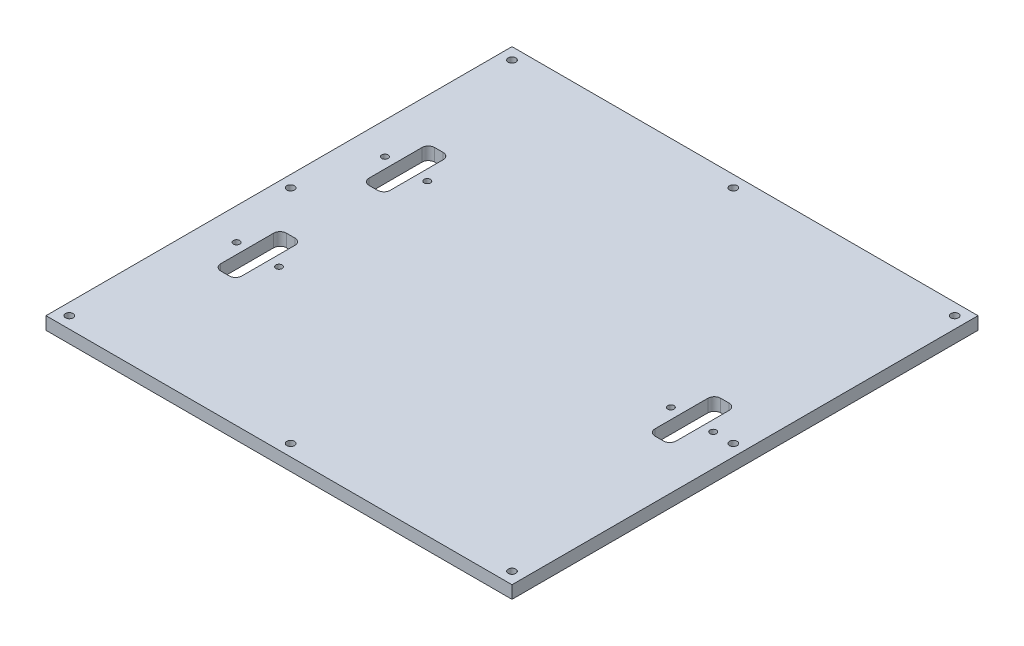
from build123d import *

# Parameters (mm, degrees)
SKETCH1_W                  = 220
SKETCH1_H                  = 220
BOSS_EXTRUDE1_DEPTH        = 6
SKETCH2_R                  = 1.5
SKETCH2_W                  = 10
SKETCH2_H                  = 31
CUT_EXTRUDE1_DEPTH         = 156.679157243
FILLET1_R                  = 3
SKETCH5_R                  = 1.5
SKETCH5_W                  = 10
SKETCH5_H                  = 31
CUT_EXTRUDE3_DEPTH         = 221.647074026
FILLET2_R                  = 3
SKETCH7_R                  = 1.5
SKETCH7_W                  = 10
SKETCH7_H                  = 31
CUT_EXTRUDE4_DEPTH         = 290.223994519
FILLET3_R                  = 3
F_3_6_3_6_DIAMETER_HOLE1_D = 3.6


with BuildPart() as part:
    # Sketch1 → Boss-Extrude1 (new body)
    with BuildSketch(Plane(origin=(0, 0, 0), x_dir=(1, 0, 0), z_dir=(0, 1, 0))):
        Rectangle(SKETCH1_W, SKETCH1_H)
    extrude(amount=BOSS_EXTRUDE1_DEPTH)

    # Sketch2 → Cut-Extrude1 (cut, through all)
    with BuildSketch(Plane(origin=(0, 6, 0), x_dir=(1, 0, 0), z_dir=(0, 1, 0))):
        with Locations((-95, 35)):
            Circle(SKETCH2_R)
        with Locations((-75, 35)):
            Circle(SKETCH2_R)
        with Locations((-85, 35)):
            Rectangle(SKETCH2_W, SKETCH2_H)
    extrude(amount=-CUT_EXTRUDE1_DEPTH, mode=Mode.SUBTRACT)

    # Fillet1
    fillet1_edges = [part.edges().sort_by_distance(p)[0] for p in [
        (-80, 3, -19.5),
        (-90, 3, -19.5),
        (-80, 3, -50.5),
        (-90, 3, -50.5),
    ]]
    fillet(fillet1_edges, radius=FILLET1_R)

    # Sketch5 → Cut-Extrude3 (cut, through all)
    with BuildSketch(Plane(origin=(45.510619452, 6, 46.414764374), x_dir=(1, 0, 0), z_dir=(0, 1, 0))):
        with Locations((-140.510619452, 11.414764374)):
            Circle(SKETCH5_R)
        with Locations((-120.510619452, 11.414764374)):
            Circle(SKETCH5_R)
        with Locations((-130.510619452, 11.414764374)):
            Rectangle(SKETCH5_W, SKETCH5_H)
    extrude(amount=-CUT_EXTRUDE3_DEPTH, mode=Mode.SUBTRACT)

    # Fillet2
    fillet2_edges = [part.edges().sort_by_distance(p)[0] for p in [
        (-80, 3, 50.5),
        (-90, 3, 50.5),
        (-80, 3, 19.5),
        (-90, 3, 19.5),
    ]]
    fillet(fillet2_edges, radius=FILLET2_R)

    # Sketch7 → Cut-Extrude4 (cut, through all)
    with BuildSketch(Plane(origin=(105.138163787, 6, 83.209962186), x_dir=(1, 0, 0), z_dir=(0, 1, 0))):
        with Locations((-30.138163787, 83.209962186)):
            Circle(SKETCH7_R)
        with Locations((-10.138163787, 83.209962186)):
            Circle(SKETCH7_R)
        with Locations((-20.138163787, 83.209962186)):
            Rectangle(SKETCH7_W, SKETCH7_H)
    extrude(amount=-CUT_EXTRUDE4_DEPTH, mode=Mode.SUBTRACT)

    # Fillet3
    fillet3_edges = [part.edges().sort_by_distance(p)[0] for p in [
        (90, 3, 15.5),
        (80, 3, 15.5),
        (90, 3, -15.5),
        (80, 3, -15.5),
    ]]
    fillet(fillet3_edges, radius=FILLET3_R)

    # Ø3.6 (3.6) Diameter Hole1 (through all)
    with Locations(Plane(origin=(0, 6, 0), x_dir=(1, 0, 0), z_dir=(0, 1, 0))):
        with Locations((-104.5, -104.5), (0, -104.5), (104.5, -104.5), (104.5, 0), (104.5, 104.5), (0, 104.5), (-104.5, 104.5), (-104.5, 0)):
            Hole(F_3_6_3_6_DIAMETER_HOLE1_D / 2)


solid = part.part
